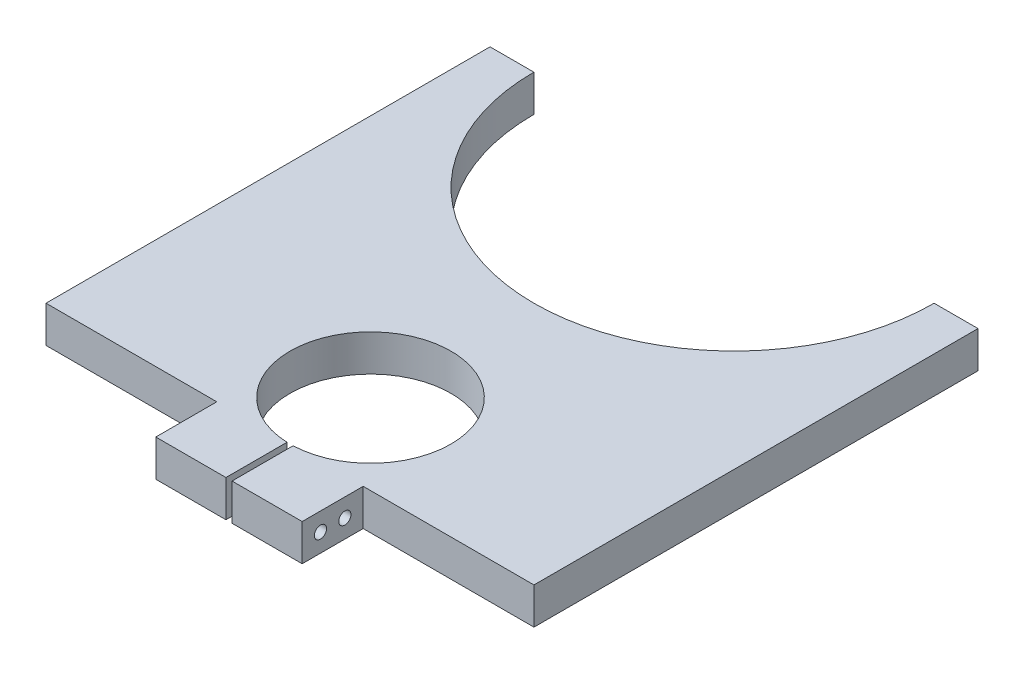
from build123d import *

# Parameters (mm, degrees)
SKETCH1_W           = 127
SKETCH1_H           = 131.445
BOSS_EXTRUDE1_DEPTH = 9.525
SKETCH2_W           = 44.45
SKETCH2_H           = 15.875
CUT_EXTRUDE1_DEPTH  = 184.023259861
CUT_EXTRUDE2_DEPTH  = 184.023259861
CUT_EXTRUDE3_DEPTH  = 184.023259861
SKETCH6_R           = 1.5875
CUT_EXTRUDE4_DEPTH  = 156.508894119


with BuildPart() as part:
    # Sketch1 → Boss-Extrude1 (new body)
    with BuildSketch(Plane(origin=(0, 0, 0), x_dir=(1, 0, 0), z_dir=(0, 1, 0))):
        with Locations((63.5, -65.7225)):
            Rectangle(SKETCH1_W, SKETCH1_H)
    extrude(amount=BOSS_EXTRUDE1_DEPTH)

    # Sketch2 → Cut-Extrude1 (cut, through all)
    with BuildSketch(Plane(origin=(0, 9.525, 0), x_dir=(1, 0, 0), z_dir=(0, 1, 0))):
        with Locations((22.225, -123.5075)):
            Rectangle(SKETCH2_W, SKETCH2_H)
        with Locations((104.775, -123.5075)):
            Rectangle(SKETCH2_W, SKETCH2_H)
    extrude(amount=-CUT_EXTRUDE1_DEPTH, mode=Mode.SUBTRACT)

    # Sketch3 → Cut-Extrude2 (cut, through all)
    with BuildSketch(Plane(origin=(0, 9.525, 0), x_dir=(1, 0, 0), z_dir=(0, 1, 0))):
        with BuildLine():
            Line((63.5, -131.445), (64.29375, -131.445))
            Line((64.29375, -131.445), (64.29375, -115.57))
            Line((64.29375, -115.57), (64.29375, -115.55496146))
            ThreePointArc((64.29375, -115.55496146), (63.5, -73.66), (62.70625, -115.55496146))
            Line((62.70625, -115.55496146), (62.70625, -115.57))
            Line((62.70625, -115.57), (62.70625, -131.445))
            Line((62.70625, -131.445), (63.5, -131.445))
        make_face()
    extrude(amount=-CUT_EXTRUDE2_DEPTH, mode=Mode.SUBTRACT)

    # Sketch5 → Cut-Extrude3 (cut, through all)
    with BuildSketch(Plane(origin=(0, 9.525, 0), x_dir=(1, 0, 0), z_dir=(0, 1, 0))):
        with BuildLine():
            ThreePointArc((11.41476, 0), (63.5, -52.08524), (115.58524, 0))
            Line((115.58524, 0), (11.41476, 0))
        make_face()
    extrude(amount=-CUT_EXTRUDE3_DEPTH, mode=Mode.SUBTRACT)

    # Sketch6 → Cut-Extrude4 (cut, through all)
    with BuildSketch(Plane.ZY.offset(-44.45)):
        with Locations((120.3325, 4.7625)):
            Circle(SKETCH6_R)
        with Locations((126.6825, 4.7625)):
            Circle(SKETCH6_R)
    extrude(amount=-CUT_EXTRUDE4_DEPTH, mode=Mode.SUBTRACT)


solid = part.part
